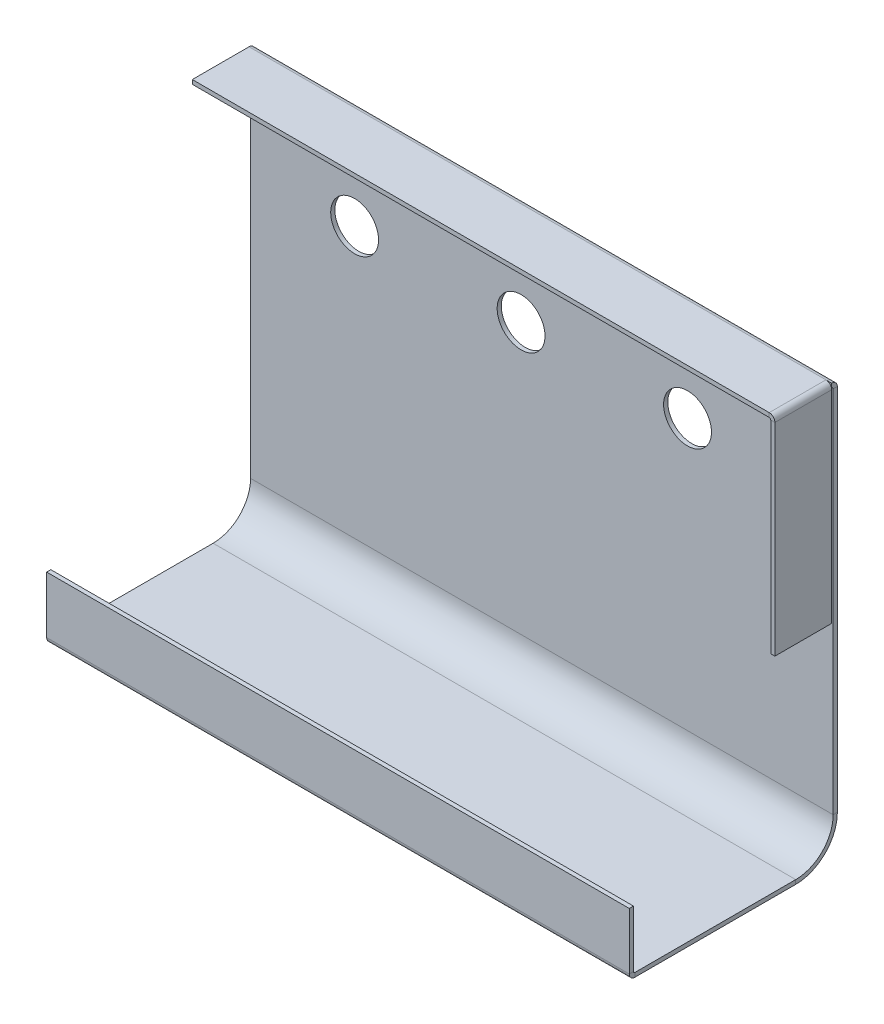
from build123d import *

# Parameters (mm, degrees)
SKETCH_2_W                       = 280
SKETCH_2_H                       = 200
SM_BASE_FLANGE_1_DEPTH           = 2
SM_EDGE_FLANGE_1_STRIP_W         = 44
SM_EDGE_FLANGE_1_STRIP_H         = 2
SM_EDGE_FLANGE_1_STRIP_CUT_DEPTH = 280
SM_EDGE_FLANGE_1_DEPTH           = 280
SM_EDGE_FLANGE_2_STRIP_W         = 9.4732
SM_EDGE_FLANGE_2_STRIP_H         = 2
SM_EDGE_FLANGE_2_STRIP_CUT_DEPTH = 280
SM_EDGE_FLANGE_2_DEPTH           = 280
SM_EDGE_FLANGE_3_STRIP_W         = 9.4732
SM_EDGE_FLANGE_3_STRIP_H         = 2
SM_EDGE_FLANGE_3_STRIP_CUT_DEPTH = 280
SM_EDGE_FLANGE_3_DEPTH           = 280
SKETCH_36_R                      = 11.5
CUT_EXTRUDE_3_DEPTH              = 10
SM_EDGE_FLANGE_4_STRIP_W         = 9.4732
SM_EDGE_FLANGE_4_STRIP_H         = 2
SM_EDGE_FLANGE_4_STRIP_CUT_DEPTH = 27.2634
SM_EDGE_FLANGE_4_DEPTH           = 27.2634
HOLE_WIZARD_M4_1_D               = 3.3


# Sheet-metal steps are written as plain solids
with BuildPart() as part:
    # Sketch 2 → 基体-法兰1 (new body)
    with BuildSketch(Plane.XY):
        Rectangle(SKETCH_2_W, SKETCH_2_H)
    extrude(amount=-SM_BASE_FLANGE_1_DEPTH)

    # 边线-法兰1 strip (across the edge) → 边线-法兰1 strip cut (cut)
    with BuildSketch(Plane(origin=(-140, -100, 0), x_dir=(0, 1, 0), z_dir=(1, 0, 0))):
        with Locations((-2, -1)):
            Rectangle(SM_EDGE_FLANGE_1_STRIP_W, SM_EDGE_FLANGE_1_STRIP_H)
    extrude(amount=SM_EDGE_FLANGE_1_STRIP_CUT_DEPTH, mode=Mode.SUBTRACT)

    # 边线-法兰1 section (across the edge) → 边线-法兰1 (add)
    with BuildSketch(Plane(origin=(-140, -100, 0), x_dir=(0, 1, 0), z_dir=(1, 0, 0))):
        with BuildLine():
            Line((0, 18), (0, 98))
            Line((0, 98), (2, 98))
            Line((2, 98), (2, 18))
            ThreePointArc((2, 18), (7.272077939, 5.272077939), (20, 0))
            Line((20, 0), (20, -2))
            ThreePointArc((20, -2), (5.857864376, 3.857864376), (0, 18))
        make_face()
    extrude(amount=SM_EDGE_FLANGE_1_DEPTH)

    # 边线-法兰2 strip (across the edge) → 边线-法兰2 strip cut (cut)
    with BuildSketch(Plane(origin=(140, 100, 0), x_dir=(0, -1, 0), z_dir=(-1, 0, 0))):
        with Locations((-2, -1)):
            Rectangle(SM_EDGE_FLANGE_2_STRIP_W, SM_EDGE_FLANGE_2_STRIP_H)
    extrude(amount=SM_EDGE_FLANGE_2_STRIP_CUT_DEPTH, mode=Mode.SUBTRACT)

    # 边线-法兰2 section (across the edge) → 边线-法兰2 (add)
    with BuildSketch(Plane(origin=(140, 100, 0), x_dir=(0, -1, 0), z_dir=(-1, 0, 0))):
        with BuildLine():
            Line((0, 0.7366), (0, 28))
            Line((0, 28), (2, 28))
            Line((2, 28), (2, 0.7366))
            ThreePointArc((2, 0.7366), (2.215745145, 0.215745145), (2.7366, 0))
            Line((2.7366, 0), (2.7366, -2))
            ThreePointArc((2.7366, -2), (0.801531583, -1.198468417), (0, 0.7366))
        make_face()
    extrude(amount=SM_EDGE_FLANGE_2_DEPTH)

    # 边线-法兰3 strip (across the edge) → 边线-法兰3 strip cut (cut)
    with BuildSketch(Plane(origin=(-140, -98, 98), x_dir=(0, 0, -1), z_dir=(1, 0, 0))):
        with Locations((-2, -1)):
            Rectangle(SM_EDGE_FLANGE_3_STRIP_W, SM_EDGE_FLANGE_3_STRIP_H)
    extrude(amount=SM_EDGE_FLANGE_3_STRIP_CUT_DEPTH, mode=Mode.SUBTRACT)

    # 边线-法兰3 section (across the edge) → 边线-法兰3 (add)
    with BuildSketch(Plane(origin=(-140, -98, 98), x_dir=(0, 0, -1), z_dir=(1, 0, 0))):
        with BuildLine():
            Line((0, 0.7366), (0, 28))
            Line((0, 28), (2, 28))
            Line((2, 28), (2, 0.7366))
            ThreePointArc((2, 0.7366), (2.215745145, 0.215745145), (2.7366, 0))
            Line((2.7366, 0), (2.7366, -2))
            ThreePointArc((2.7366, -2), (0.801531583, -1.198468417), (0, 0.7366))
        make_face()
    extrude(amount=SM_EDGE_FLANGE_3_DEPTH)

    # 草图36 → 切除-拉伸3 (cut)
    with BuildSketch(Plane(origin=(0, 0, -2), x_dir=(-1, 0, 0), z_dir=(0, 0, -1))):
        with Locations((-70, 50)):
            Circle(SKETCH_36_R)
        with Locations((10, 50)):
            Circle(SKETCH_36_R)
        with Locations((90, 50)):
            Circle(SKETCH_36_R)
    extrude(amount=-CUT_EXTRUDE_3_DEPTH, mode=Mode.SUBTRACT)

    # 边线-法兰4 strip (across the edge) → 边线-法兰4 strip cut (cut)
    with BuildSketch(Plane(origin=(140, 98, 0.7366), x_dir=(-1, 0, 0), z_dir=(0, 0, 1))):
        with Locations((-2, -1)):
            Rectangle(SM_EDGE_FLANGE_4_STRIP_W, SM_EDGE_FLANGE_4_STRIP_H)
    extrude(amount=SM_EDGE_FLANGE_4_STRIP_CUT_DEPTH, mode=Mode.SUBTRACT)

    # 边线-法兰4 section (across the edge) → 边线-法兰4 (add)
    with BuildSketch(Plane(origin=(140, 98, 0.7366), x_dir=(-1, 0, 0), z_dir=(0, 0, 1))):
        with BuildLine():
            Line((0, 0.7366), (0, 98))
            Line((0, 98), (2, 98))
            Line((2, 98), (2, 0.7366))
            ThreePointArc((2, 0.7366), (2.215745145, 0.215745145), (2.7366, 0))
            Line((2.7366, 0), (2.7366, -2))
            ThreePointArc((2.7366, -2), (0.801531583, -1.198468417), (0, 0.7366))
        make_face()
    extrude(amount=SM_EDGE_FLANGE_4_DEPTH)

    # M4 螺纹孔1 (through all)
    with Locations(Plane(origin=(0, 0, -2), x_dir=(-1, 0, 0), z_dir=(0, 0, -1))):
        with Locations((-107, 92), (113, 92)):
            Hole(HOLE_WIZARD_M4_1_D / 2)


solid = part.part
